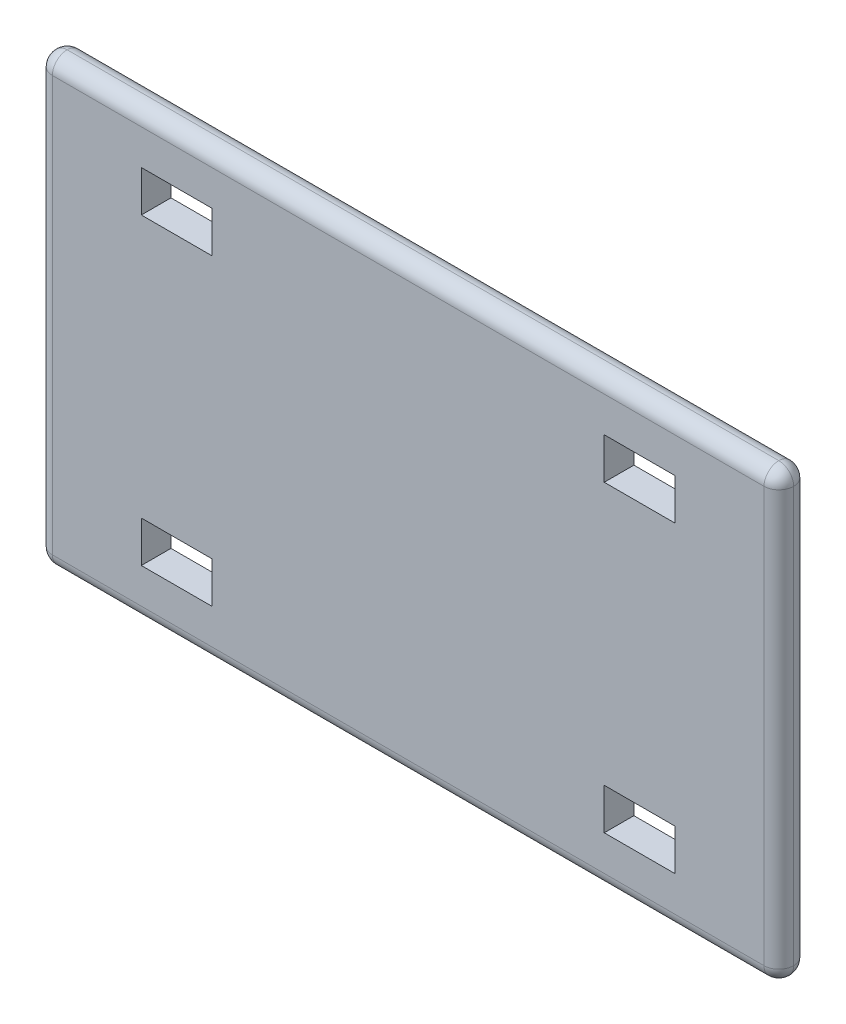
from build123d import *

# Parameters (mm, degrees)
SKETCH_1_W          = 20
SKETCH_1_H          = 12
EXTRUDE_1_DEPTH     = 0.8
FILLET_2_R          = 0.4
SKETCH_2_W          = 1.91
SKETCH_2_H          = 1.11
CUT_EXTRUDE_1_DEPTH = 14.307269619


with BuildPart() as part:
    # 草图1 → 凸台-拉伸1 (new body)
    with BuildSketch(Plane.XY):
        with Locations((0.967032967, -1.494505495)):
            Rectangle(SKETCH_1_W, SKETCH_1_H)
    extrude(amount=EXTRUDE_1_DEPTH)

    # 圆角2
    fillet_2_edges = [part.edges().sort_by_distance(p)[0] for p in [
        (10.967032967, -1.494505495, 0.8),
        (0.967032967, 4.505494505, 0.8),
        (-9.032967033, -1.494505495, 0.8),
        (0.967032967, 4.505494505, 0),
        (10.967032967, -1.494505495, 0),
        (0.967032967, -7.494505495, 0),
        (-9.032967033, -1.494505495, 0),
        (0.967032967, -7.494505495, 0.8),
        (-9.032967033, 4.505494505, 0.4),
        (10.967032967, 4.505494505, 0.4),
        (10.967032967, -7.494505495, 0.4),
        (-9.032967033, -7.494505495, 0.4),
    ]]
    fillet(fillet_2_edges, radius=FILLET_2_R - 0.0001)  # a hair under: the kernel refuses the full size

    # 草图2 → 切除-拉伸1 (cut, through all)
    with BuildSketch(Plane(origin=(0, 0, 0), x_dir=(-1, 0, 0), z_dir=(0, 0, -1))):
        with Locations((-7.212032967, 2.600494505)):
            Rectangle(SKETCH_2_W, SKETCH_2_H)
        with Locations((-7.212032967, -5.589505495)):
            Rectangle(SKETCH_2_W, SKETCH_2_H)
        with Locations((5.277967033, 2.600494505)):
            Rectangle(SKETCH_2_W, SKETCH_2_H)
        with Locations((5.277967033, -5.589505495)):
            Rectangle(SKETCH_2_W, SKETCH_2_H)
    extrude(amount=-CUT_EXTRUDE_1_DEPTH, mode=Mode.SUBTRACT)


solid = part.part
